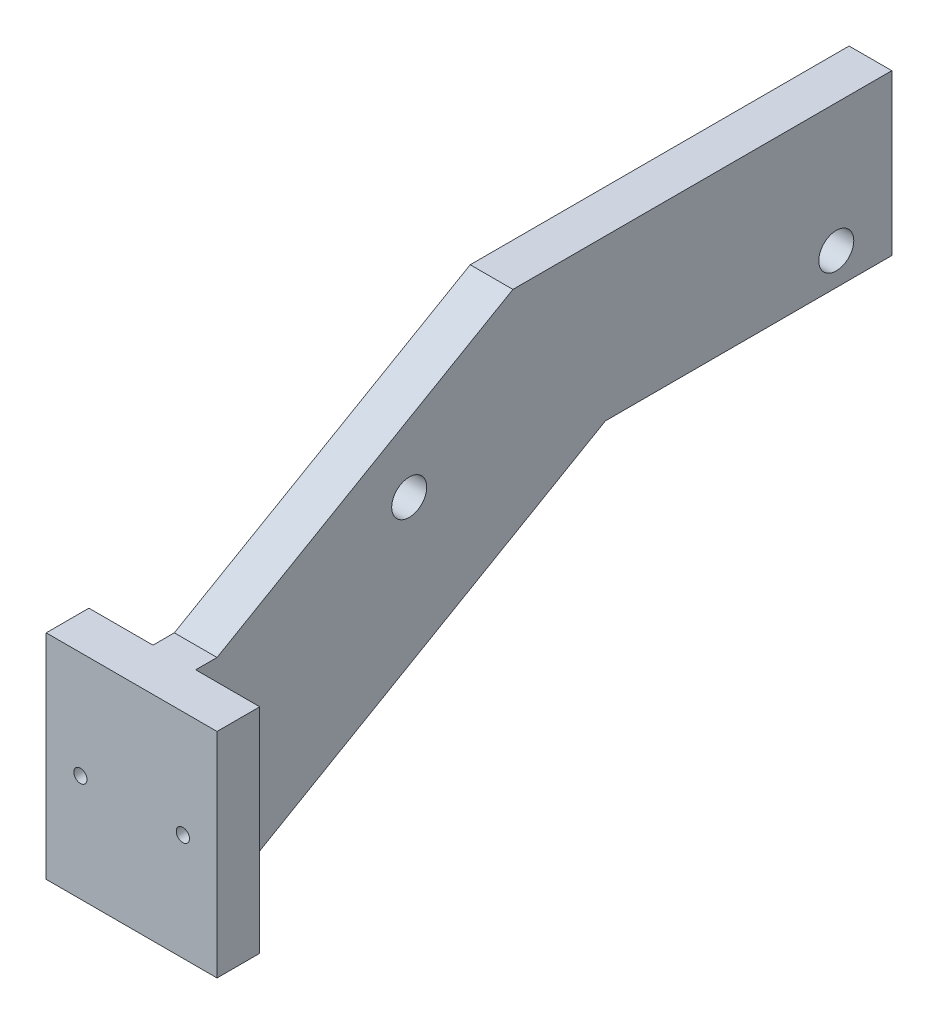
from build123d import *

# Parameters (mm, degrees)
SALIENTE_EXTRUIR1_DEPTH = 10
SALIENTE_EXTRUIR2_DEPTH = 10
CROQUIS3_R              = 1.55
CORTAR_EXTRUIR1_DEPTH   = 10
CROQUIS4_R              = 4.1
CORTAR_EXTRUIR2_DEPTH   = 10


with BuildPart() as part:
    # Croquis1 → Saliente-Extruir1 (new body)
    with BuildSketch(Plane(origin=(0, 0, 0), x_dir=(0, 0, -1), z_dir=(1, 0, 0))):
        Polygon((0, 0), (0, 50), (15, 50), (84.282032303, 90), (173.002060716, 90), (173.002060716, 52.5), (105.932667397, 52.5), (15, 0), align=None)
    extrude(amount=SALIENTE_EXTRUIR1_DEPTH)

    # Croquis2 → Saliente-Extruir2 (add)
    with BuildSketch(Plane.XY):
        Polygon((0, 50), (-15, 50), (-15, 0), (25, 0), (25, 50), align=None)
    extrude(amount=-SALIENTE_EXTRUIR2_DEPTH)

    # Croquis3 → Cortar-Extruir1 (cut)
    with BuildSketch(Plane.XY):
        with Locations((-7, 25)):
            Circle(CROQUIS3_R)
        with Locations((17, 25)):
            Circle(CROQUIS3_R)
    extrude(amount=-CORTAR_EXTRUIR1_DEPTH, mode=Mode.SUBTRACT)

    # Croquis4 → Cortar-Extruir2 (cut)
    with BuildSketch(Plane(origin=(10, 0, 0), x_dir=(0, 0, -1), z_dir=(1, 0, 0))):
        with Locations((60, 60)):
            Circle(CROQUIS4_R)
        with Locations((160, 60)):
            Circle(CROQUIS4_R)
    extrude(amount=-CORTAR_EXTRUIR2_DEPTH, mode=Mode.SUBTRACT)


solid = part.part
